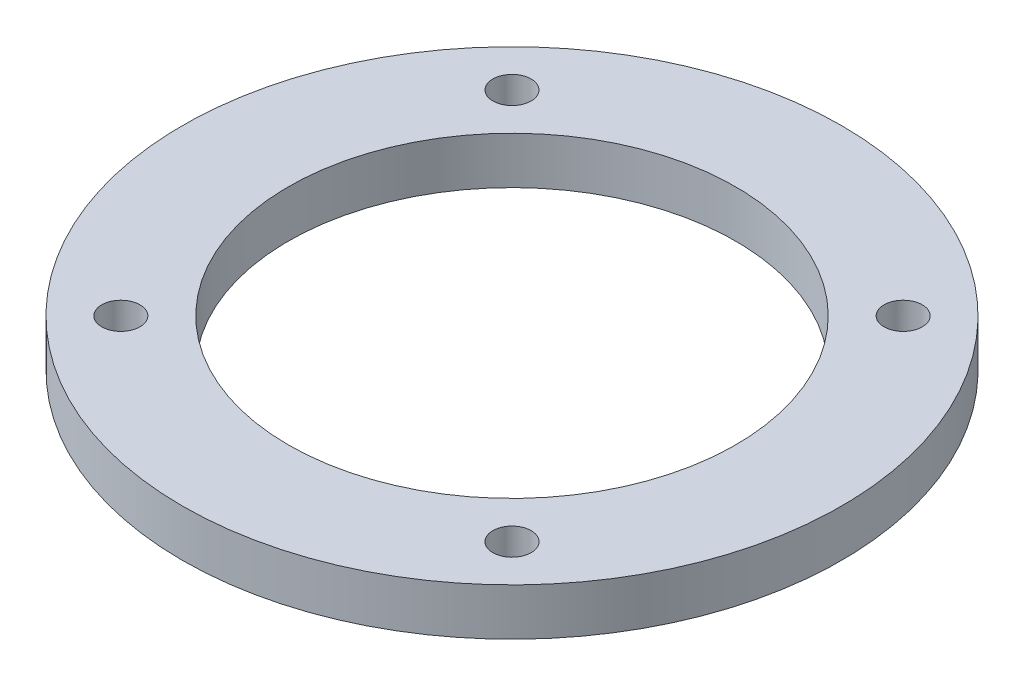
from build123d import *

# Parameters (mm, degrees)
SKETCH1_W                            = 177.8
SKETCH1_H                            = 177.8
BOSS_EXTRUDE1_DEPTH                  = 12.7
F_13_32_0_40625_DIAMETER_HOLE1_D     = 10.31875
F_13_32_0_40625_DIAMETER_HOLE1_DEPTH = 25.4
F_13_32_0_40625_DIAMETER_HOLE1_TIP   = 3.100065256
SKETCH4_R                            = 60.325
CUT_EXTRUDE1_DEPTH                   = 127.363404513
SKETCH5_OUTSIDE_W                    = 230.154
SKETCH5_OUTSIDE_H                    = 230.154
SKETCH5_OUTSIDE_R                    = 88.9
CUT_EXTRUDE2_DEPTH                   = 12.7


with BuildPart() as part:
    # Sketch1 → Boss-Extrude1 (new body)
    with BuildSketch(Plane(origin=(0, 0, 0), x_dir=(1, 0, 0), z_dir=(0, 1, 0))):
        Rectangle(SKETCH1_W, SKETCH1_H)
    extrude(amount=BOSS_EXTRUDE1_DEPTH)

    # 13/32 (0.40625) Diameter Hole1
    with Locations(Plane(origin=(-52.759004711, 12.7, -52.759004711), x_dir=(0, 0, 1), z_dir=(0, 1, 0))):
        with Locations((0, 0), (0, 105.518009422), (105.518009422, 105.518009422), (105.518009422, 0)):
            Hole(F_13_32_0_40625_DIAMETER_HOLE1_D / 2, depth=F_13_32_0_40625_DIAMETER_HOLE1_DEPTH)
            with Locations((0, 0, -(F_13_32_0_40625_DIAMETER_HOLE1_DEPTH + F_13_32_0_40625_DIAMETER_HOLE1_TIP / 2))):  # 118° drill point
                Cone(0, F_13_32_0_40625_DIAMETER_HOLE1_D / 2, F_13_32_0_40625_DIAMETER_HOLE1_TIP, mode=Mode.SUBTRACT)

    # Sketch4 → Cut-Extrude1 (cut, through all)
    with BuildSketch(Plane(origin=(0, 12.7, 0), x_dir=(1, 0, 0), z_dir=(0, 1, 0))):
        Circle(SKETCH4_R)
    extrude(amount=-CUT_EXTRUDE1_DEPTH, mode=Mode.SUBTRACT)

    # Sketch5 outside → Cut-Extrude2 (cut)
    with BuildSketch(Plane(origin=(0, 12.7, 0), x_dir=(1, 0, 0), z_dir=(0, 1, 0))):
        Rectangle(SKETCH5_OUTSIDE_W, SKETCH5_OUTSIDE_H)
        Circle(SKETCH5_OUTSIDE_R, mode=Mode.SUBTRACT)
    extrude(amount=-CUT_EXTRUDE2_DEPTH, mode=Mode.SUBTRACT)


solid = part.part
